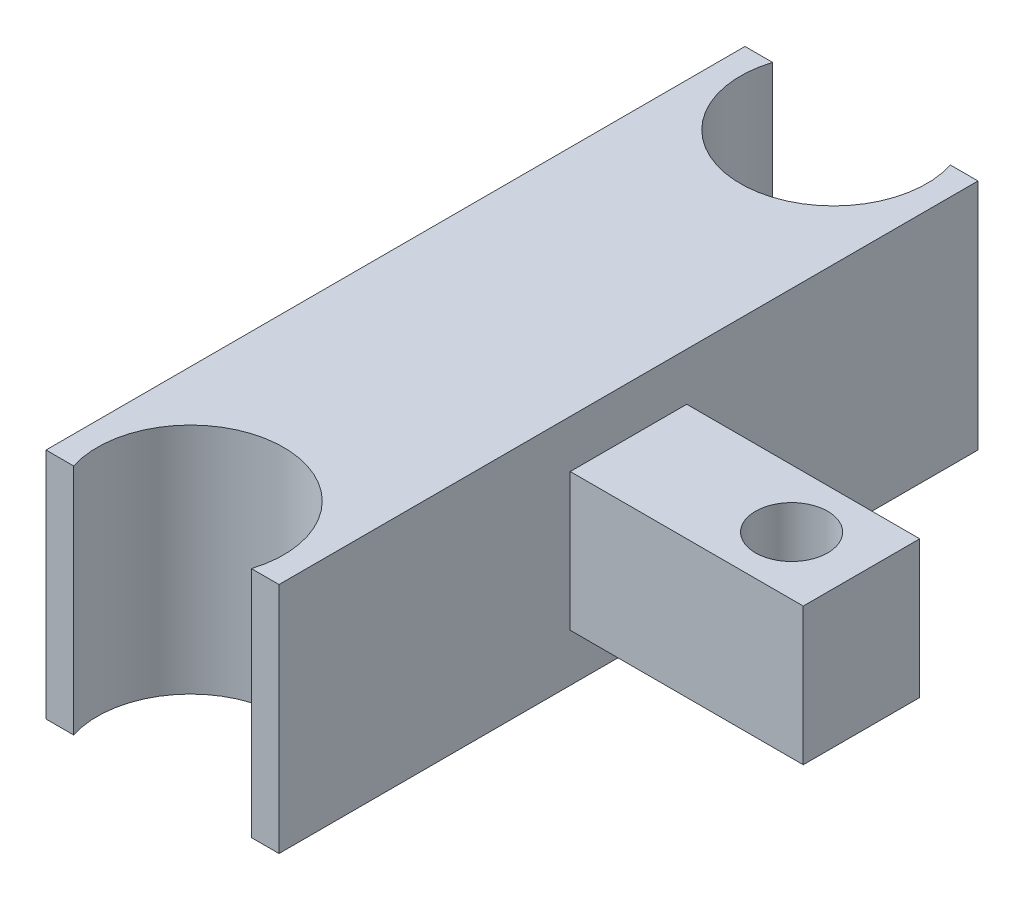
from build123d import *

# Parameters (mm, degrees)
SKETCH_1_W          = 10
SKETCH_1_H          = 5
SKETCH_1_R          = 1.55
EXTRUDE_1_DEPTH     = 5.9
SKETCH_2_W          = 30
SKETCH_2_H          = 10
EXTRUDE_2_DEPTH     = 10
SKETCH_3_R          = 4
CUT_EXTRUDE_1_DEPTH = 10


with BuildPart() as part:
    # 草图1 → 凸台-拉伸1 (new body)
    with BuildSketch(Plane(origin=(0, 0, 0), x_dir=(1, 0, 0), z_dir=(0, 1, 0))):
        with Locations((5, 2.5)):
            Rectangle(SKETCH_1_W, SKETCH_1_H)
        with Locations((7, 2.5)):
            Circle(SKETCH_1_R, mode=Mode.SUBTRACT)
    extrude(amount=EXTRUDE_1_DEPTH)

    # 草图2 → 凸台-拉伸2 (add)
    with BuildSketch(Plane.ZY):
        with Locations((-2.5, 2.95)):
            Rectangle(SKETCH_2_W, SKETCH_2_H)
    extrude(amount=EXTRUDE_2_DEPTH)

    # 草图3 → 切除-拉伸1 (cut)
    with BuildSketch(Plane(origin=(0, 7.95, 0), x_dir=(1, 0, 0), z_dir=(0, 1, 0))):
        with Locations((-5, 16.3)):
            Circle(SKETCH_3_R)
        with Locations((-5, -11.3)):
            Circle(SKETCH_3_R)
    extrude(amount=-CUT_EXTRUDE_1_DEPTH, mode=Mode.SUBTRACT)


solid = part.part
